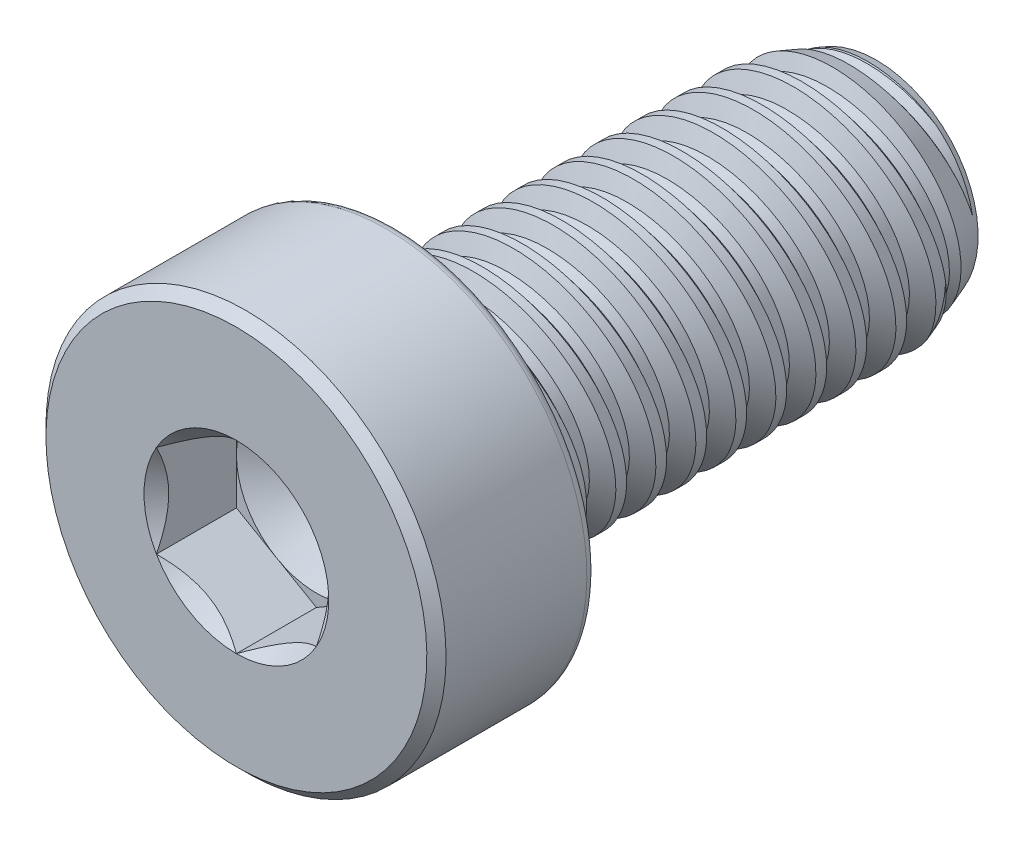
from build123d import *

# Parameters (mm, degrees)
SKETCH1_W            = 12
SKETCH1_H            = 3
LPATTERN1_COUNT      = 12
LPATTERN1_PITCH      = 1
LPATTERN1_COUNT_DIR2 = 2
LPATTERN1_PITCH_DIR2 = 1
SKETCH4_R            = 5
EXTRUDE1_DEPTH       = 4
CUT_EXTRUDE1_DEPTH   = 2
SKETCH7_R            = 2.309401077
CUT_EXTRUDE4_DEPTH   = 2
CUT_EXTRUDE4_DRAFT   = -45
SKETCH8_R            = 2
CUT_EXTRUDE5_DEPTH   = 0.666666667
CUT_EXTRUDE5_DRAFT   = -60


with BuildPart() as part:
    # Sketch1 → Revolve1 (revolve)
    with BuildSketch(Plane(origin=(0, 0, 0), x_dir=(0, 0, -1), z_dir=(1, 0, 0)), mode=Mode.PRIVATE) as revolve1_sk:
        with Locations((6, 1.5)):
            Rectangle(SKETCH1_W, SKETCH1_H)
    revolve(revolve1_sk.sketch.rotate(Axis((0, 0, 0), (0, 0, 1)), 143.496238264), axis=Axis((0, 0, 0), (0, 0, 1)))

    # Sketch2 → Cut-Revolve1 (revolve, cut)
    with BuildSketch(Plane(origin=(0, 0, 0), x_dir=(0, 0, -1), z_dir=(1, 0, 0)), mode=Mode.PRIVATE) as cut_revolve1_sk:
        Polygon((0.12329924, 3.020549873), (0.986393924, 3.164398987), (0.767129385, 2.579122931), (0.520530904, 2.538023184), align=None)
    cut_revolve1 = revolve(cut_revolve1_sk.sketch.rotate(Axis((0, -0.178376498, 0), (0, 0.1643989873053576, -0.9863939238321437)), 180), axis=Axis((0, -0.178376498, 0), (0, 0.1643989873053576, -0.9863939238321437)), mode=Mode.SUBTRACT)

    # Sketch3 → Cut-Revolve2 (revolve, cut)
    with BuildSketch(Plane(origin=(0, 0, 0), x_dir=(0, 0, -1), z_dir=(1, 0, 0)), mode=Mode.PRIVATE) as cut_revolve2_sk:
        Polygon((12, 2.538023184), (10.730729131, 3), (12, 3), align=None)
    revolve(cut_revolve2_sk.sketch.rotate(Axis((0, 0, -10.730729131), (0, 0, 1)), 143.496238264), axis=Axis((0, 0, -10.730729131), (0, 0, 1)), mode=Mode.SUBTRACT)

    # LPattern1: Cut-Revolve1 12 × 2
    with Locations(*[Vector(0, 0, -1) * (i * LPATTERN1_PITCH) + Vector(0, 0, 1) * (j * LPATTERN1_PITCH_DIR2) for i in range(LPATTERN1_COUNT) for j in range(LPATTERN1_COUNT_DIR2) if (i, j) != (0, 0)]):
        add(cut_revolve1, mode=Mode.SUBTRACT)

    # Sketch4 → Extrude1 (add)
    with BuildSketch(Plane.XY):
        with Locations(Location((0, 0, 0), (0, 0, 90))):
            Circle(SKETCH4_R)
    extrude(amount=EXTRUDE1_DEPTH)

    # Sketch10 → Cut-Revolve3 (revolve, cut)
    with BuildSketch(Plane(origin=(0, 0, 0), x_dir=(0, 0, -1), z_dir=(1, 0, 0))):
        with BuildLine():
            Line((-4, 4.76), (-3.76, 5))
            Line((-3.76, 5), (-0.24, 5))
            ThreePointArc((-0.24, 5), (-0.070294373, 4.929705627), (0, 4.76))
            Line((0, 4.76), (0.1, 4.76))
            Line((0.1, 4.76), (0.1, 5.1))
            Line((0.1, 5.1), (-4, 5.1))
            Line((-4, 5.1), (-4, 4.76))
        make_face()
    revolve(axis=Axis((0, 0, 4), (0, 0, 1)), mode=Mode.SUBTRACT)

    # Sketch6 → Cut-Extrude1 (cut)
    with BuildSketch(Plane.XY.offset(4)):
        Polygon((0, -2.309401077), (2, -1.154700538), (2, 1.154700538), (0, 2.309401077), (-2, 1.154700538), (-2, -1.154700538), align=None)
    extrude(amount=-CUT_EXTRUDE1_DEPTH, mode=Mode.SUBTRACT)


with BuildPart() as cut_extrude4_tool:
    # Sketch7 → Cut-Extrude4 (with draft: the straight prism first)
    with BuildSketch(Plane.XY.offset(4)):
        Circle(SKETCH7_R)
    extrude(amount=-CUT_EXTRUDE4_DEPTH)
    # Cut-Extrude4: the draft: its side faces are tilted about the plane it starts from
    cut_extrude4_sides = [cut_extrude4_tool.faces().sort_by_distance(p)[0] for p in [
        (-2.309401077, 0, 3),
    ]]
    draft(cut_extrude4_sides, Plane.XY.offset(4), CUT_EXTRUDE4_DRAFT)


with BuildPart() as part_1:
    add(part.part)

    # Cut-Extrude4: cut by cut_extrude4_tool
    add(cut_extrude4_tool.part, mode=Mode.SUBTRACT)


with BuildPart() as cut_extrude5_tool:
    # Sketch8 → Cut-Extrude5 (with draft: the straight prism first)
    with BuildSketch(Plane.XY.offset(2)):
        Circle(SKETCH8_R)
    extrude(amount=-CUT_EXTRUDE5_DEPTH)
    # Cut-Extrude5: the draft: its side faces are tilted about the plane it starts from
    cut_extrude5_sides = [cut_extrude5_tool.faces().sort_by_distance(p)[0] for p in [
        (-2, 0, 1.666666667),
    ]]
    draft(cut_extrude5_sides, Plane.XY.offset(2), CUT_EXTRUDE5_DRAFT)


with BuildPart() as part_2:
    add(part_1.part)

    # Cut-Extrude5: cut by cut_extrude5_tool
    add(cut_extrude5_tool.part, mode=Mode.SUBTRACT)


solid = part_2.part
